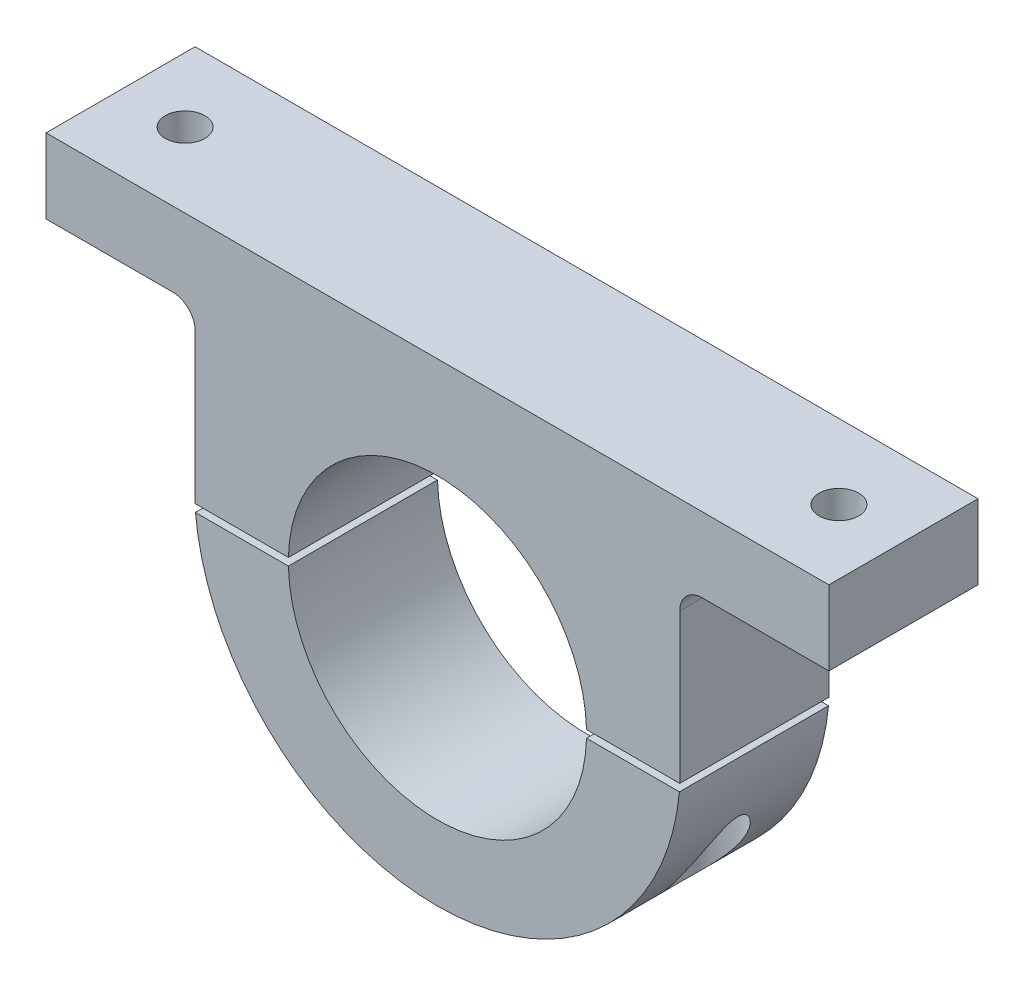
from build123d import *

# Parameters (mm, degrees)
SKETCH1_R                 = 50.8
BOSS_EXTRUDE1_DEPTH       = 50.8
CUT_EXTRUDE1_DEPTH        = 130.090044469
CUT_EXTRUDE1_DEPTH_BACK   = 130.090044469
SKETCH2_W                 = 165.1
SKETCH2_H                 = 2.54
ADVANCEDHOLE1_START       = -54.125920427
ADVANCEDHOLE1_OUTLINE_R   = 10.31875
ADVANCEDHOLE1_DEPTH       = 41.425920427
ADVANCEDHOLE1_START_2     = -12.7
ADVANCEDHOLE1_2_OUTLINE_R = 6.74624
ADVANCEDHOLE1_2_DEPTH     = 11.43
SKETCH10_W                = 50.8
SKETCH10_H                = 25.4
BOSS_EXTRUDE2_DEPTH       = 50.8
FILLET1_R                 = 7.62


# Read off the part's stored shape, not the designer's step: AdvancedHole1
with BuildPart() as part:
    # Sketch1 → Boss-Extrude1 (new body)
    with BuildSketch(Plane.XY):
        with BuildLine():
            Line((82.55, 85.259), (-82.55, 85.259))
            Line((-82.55, 85.259), (-82.55, 0))
            ThreePointArc((-82.55, 0), (0, -76.2), (82.55, 0))
            Line((82.55, 0), (82.55, 85.259))
        make_face()
        Circle(SKETCH1_R, mode=Mode.SUBTRACT)
    extrude(amount=-BOSS_EXTRUDE1_DEPTH)

    # Sketch2 → Cut-Extrude1 (cut, two sides: drawn at the far end of the back side and taken through both)
    with BuildSketch(Plane.XY.offset(-CUT_EXTRUDE1_DEPTH_BACK)):
        Rectangle(SKETCH2_W, SKETCH2_H)
    extrude(amount=CUT_EXTRUDE1_DEPTH + CUT_EXTRUDE1_DEPTH_BACK, mode=Mode.SUBTRACT)


with BuildPart() as cut_extrude1_piece_1:
    # of the separate pieces the step leaves, piece 1, a body of its own (cut_extrude1_pieces)
    add(part.part.solids().sort_by_distance((82.55, 1.27, 0))[0])

    # AdvancedHole1 3 outline → AdvancedHole1 3 (revolve, cut)
    with BuildSketch(Plane(origin=(66.61125751, 0, -25.4), x_dir=(1, 0, 0), z_dir=(0, 0, 1))):
        Polygon((5.35813, 1.27), (5.35813, 49.53), (0, 52.749489309), (0, 1.27), align=None)
    revolve(axis=Axis((66.61125751, 0, -25.4), (0, 1, 0)), mode=Mode.SUBTRACT)

    # AdvancedHole1 4 outline → AdvancedHole1 4 (revolve, cut)
    with BuildSketch(Plane(origin=(-66.61125751, 0, -25.4), x_dir=(1, 0, 0), z_dir=(0, 0, 1))):
        Polygon((5.35813, 1.27), (5.35813, 49.53), (0, 52.749489309), (0, 1.27), align=None)
    revolve(axis=Axis((-66.61125751, 0, -25.4), (0, 1, 0)), mode=Mode.SUBTRACT)

    # Sketch10 → Boss-Extrude2 (add)
    with BuildSketch(Plane(origin=(82.55, 0, 0), x_dir=(0, 0, -1), z_dir=(1, 0, 0))):
        with Locations((25.4, 72.559)):
            Rectangle(SKETCH10_W, SKETCH10_H)
    boss_extrude2 = extrude(amount=BOSS_EXTRUDE2_DEPTH)

    # Sketch12 → CBORE for 1/2 Socket Head Cap Screw1 (revolve, cut)
    with BuildSketch(Plane(origin=(111.37138, 59.859, -25.4), x_dir=(0, 0, -1), z_dir=(1, 0, 0))):
        Polygon((0, 0), (0, 25.401), (6.74624, 25.401), (6.74624, 12.7), (10.31875, 12.7), (10.31875, 0.635), (10.95375, 0), align=None)
    cbore_for_1_2_socket_head_cap_screw1 = revolve(axis=Axis((111.37138, 53.509, -25.4), (0, 1, 0)), mode=Mode.SUBTRACT)

    # Mirror1: Boss-Extrude2, CBORE for 1/2 Socket Head Cap Screw1 across plane
    add(boss_extrude2.mirror(Plane(origin=(0, 0, 0), x_dir=(0, 0, 1), z_dir=(1, 0, 0))))
    add(cbore_for_1_2_socket_head_cap_screw1.mirror(Plane(origin=(0, 0, 0), x_dir=(0, 0, 1), z_dir=(1, 0, 0))), mode=Mode.SUBTRACT)

    # Fillet1
    fillet1_edges = [cut_extrude1_piece_1.edges().sort_by_distance(p)[0] for p in [
        (82.55, 59.859, -25.4),
        (-82.55, 59.859, -25.4),
    ]]
    fillet(fillet1_edges, radius=FILLET1_R)


with BuildPart() as cut_extrude1_piece_2:
    # of the separate pieces the step leaves, piece 2, a body of its own (cut_extrude1_pieces)
    add(part.part.solids().sort_by_distance((-82.438392502, -1.27, 0))[0])

    # AdvancedHole1 outline → AdvancedHole1 (cut)
    with BuildSketch(Plane(origin=(0, 0, 0), x_dir=(1, 0, 0), z_dir=(0, 1, 0)).offset(ADVANCEDHOLE1_START)):
        with Locations((66.61125751, 25.4)):
            Circle(ADVANCEDHOLE1_OUTLINE_R)
        with Locations((-66.61125751, 25.4)):
            Circle(ADVANCEDHOLE1_OUTLINE_R)
    extrude(amount=ADVANCEDHOLE1_DEPTH, mode=Mode.SUBTRACT)

    # AdvancedHole1 2 outline → AdvancedHole1 2 (cut)
    with BuildSketch(Plane(origin=(0, 0, 0), x_dir=(1, 0, 0), z_dir=(0, 1, 0)).offset(ADVANCEDHOLE1_START_2)):
        with Locations((66.61125751, 25.4)):
            Circle(ADVANCEDHOLE1_2_OUTLINE_R)
        with Locations((-66.61125751, 25.4)):
            Circle(ADVANCEDHOLE1_2_OUTLINE_R)
    extrude(amount=ADVANCEDHOLE1_2_DEPTH, mode=Mode.SUBTRACT)


solid = Compound([cut_extrude1_piece_1.part, cut_extrude1_piece_2.part])
